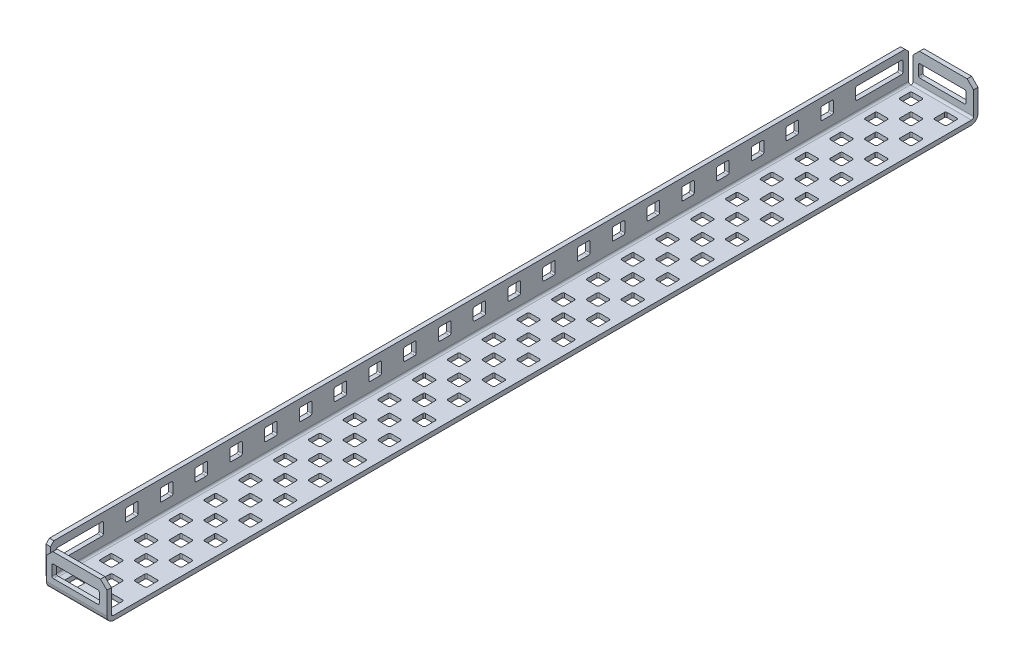
from build123d import *

# Parameters (mm, degrees)
BOSS_EXTRUDE1_DEPTH  = 313.436
CUT_EXTRUDE1_DEPTH   = 315.676979316
CUT_EXTRUDE2_DEPTH   = 315.676979316
LPATTERN1_COUNT      = 21
LPATTERN1_PITCH      = 12.7
CUT_EXTRUDE3_DEPTH   = 315.613333758
LPATTERN2_COUNT      = 2
LPATTERN2_PITCH      = 12.7
LPATTERN2_COUNT_DIR2 = 25
LPATTERN2_PITCH_DIR2 = 12.7
CUT_EXTRUDE4_DEPTH   = 315.613333758
LPATTERN3_COUNT      = 24
LPATTERN3_PITCH      = 12.7
BOSS_EXTRUDE2_DEPTH  = 22.098
CUT_EXTRUDE5_DEPTH   = 320.433628506


with BuildPart() as part:
    # Sketch1 → Boss-Extrude1 (new body)
    with BuildSketch(Plane.XY):
        with BuildLine():
            Line((0, 0), (-22.098, 0))
            ThreePointArc((-22.098, 0), (-23.894051224, 0.743948776), (-24.638, 2.54))
            Line((-24.638, 2.54), (-24.638, 13.1318))
            Line((-24.638, 13.1318), (-23.0124, 13.1318))
            Line((-23.0124, 13.1318), (-23.0124, 2.3876))
            ThreePointArc((-23.0124, 2.3876), (-22.789215367, 1.848784633), (-22.2504, 1.6256))
            Line((-22.2504, 1.6256), (0, 1.6256))
            Line((0, 1.6256), (0, 0))
        make_face()
    extrude(amount=-BOSS_EXTRUDE1_DEPTH)

    # Sketch3 → Cut-Extrude1 (cut, through all)
    with BuildSketch(Plane.ZY.offset(24.638)):
        with BuildLine():
            Line((-2.54, 10.3378), (-18.796, 10.3378))
            ThreePointArc((-18.796, 10.3378), (-19.155210245, 10.189010245), (-19.304, 9.8298))
            Line((-19.304, 9.8298), (-19.304, 6.2738))
            ThreePointArc((-19.304, 6.2738), (-19.155210245, 5.914589755), (-18.796, 5.7658))
            Line((-18.796, 5.7658), (-2.54, 5.7658))
            ThreePointArc((-2.54, 5.7658), (-2.180789755, 5.914589755), (-2.032, 6.2738))
            Line((-2.032, 6.2738), (-2.032, 9.8298))
            ThreePointArc((-2.032, 9.8298), (-2.180789755, 10.189010245), (-2.54, 10.3378))
        make_face()
        Polygon((-1.257235857, 13.1318), (0, 11.874564143), (0, 13.1318), align=None)
        Polygon((-313.436, 13.1318), (-313.436, 11.874564143), (-312.178764143, 13.1318), align=None)
        with BuildLine():
            Line((-310.896, 10.3378), (-294.64, 10.3378))
            ThreePointArc((-294.64, 10.3378), (-294.280789755, 10.189010245), (-294.132, 9.8298))
            Line((-294.132, 9.8298), (-294.132, 6.2738))
            ThreePointArc((-294.132, 6.2738), (-294.280789755, 5.914589755), (-294.64, 5.7658))
            Line((-294.64, 5.7658), (-310.896, 5.7658))
            ThreePointArc((-310.896, 5.7658), (-311.255210245, 5.914589755), (-311.404, 6.2738))
            Line((-311.404, 6.2738), (-311.404, 9.8298))
            ThreePointArc((-311.404, 9.8298), (-311.255210245, 10.189010245), (-310.896, 10.3378))
        make_face()
    extrude(amount=-CUT_EXTRUDE1_DEPTH, mode=Mode.SUBTRACT)

    # Sketch4 → Cut-Extrude2 (cut, through all)
    with BuildSketch(Plane.ZY.offset(24.638)):
        with BuildLine():
            Line((-27.94, 10.3378), (-31.496, 10.3378))
            ThreePointArc((-31.496, 10.3378), (-31.855210245, 10.189010245), (-32.004, 9.8298))
            Line((-32.004, 9.8298), (-32.004, 6.2738))
            ThreePointArc((-32.004, 6.2738), (-31.855210245, 5.914589755), (-31.496, 5.7658))
            Line((-31.496, 5.7658), (-27.94, 5.7658))
            ThreePointArc((-27.94, 5.7658), (-27.580789755, 5.914589755), (-27.432, 6.2738))
            Line((-27.432, 6.2738), (-27.432, 9.8298))
            ThreePointArc((-27.432, 9.8298), (-27.580789755, 10.189010245), (-27.94, 10.3378))
        make_face()
    cut_extrude2 = extrude(amount=-CUT_EXTRUDE2_DEPTH, mode=Mode.SUBTRACT)

    # LPattern1: Cut-Extrude2 ×21
    with Locations(*[(0, 0, -i * LPATTERN1_PITCH) for i in range(1, LPATTERN1_COUNT)]):
        add(cut_extrude2, mode=Mode.SUBTRACT)

    # Sketch5 → Cut-Extrude3 (cut, through all)
    with BuildSketch(Plane(origin=(0, 1.6256, 0), x_dir=(1, 0, 0), z_dir=(0, 1, 0))):
        with BuildLine():
            Line((-3.302, 2.032), (-6.858, 2.032))
            ThreePointArc((-6.858, 2.032), (-7.217210245, 2.180789755), (-7.366, 2.54))
            Line((-7.366, 2.54), (-7.366, 6.096))
            ThreePointArc((-7.366, 6.096), (-7.217210245, 6.455210245), (-6.858, 6.604))
            Line((-6.858, 6.604), (-3.302, 6.604))
            ThreePointArc((-3.302, 6.604), (-2.942789755, 6.455210245), (-2.794, 6.096))
            Line((-2.794, 6.096), (-2.794, 2.54))
            ThreePointArc((-2.794, 2.54), (-2.942789755, 2.180789755), (-3.302, 2.032))
        make_face()
    cut_extrude3 = extrude(amount=-CUT_EXTRUDE3_DEPTH, mode=Mode.SUBTRACT)

    # LPattern2: Cut-Extrude3 2 × 25
    with Locations(*[(-i * LPATTERN2_PITCH, 0, -j * LPATTERN2_PITCH_DIR2) for i in range(LPATTERN2_COUNT) for j in range(LPATTERN2_COUNT_DIR2) if (i, j) != (0, 0)]):
        add(cut_extrude3, mode=Mode.SUBTRACT)

    # Sketch6 → Cut-Extrude4 (cut, through all)
    with BuildSketch(Plane(origin=(0, 1.6256, 0), x_dir=(1, 0, 0), z_dir=(0, 1, 0))):
        with BuildLine():
            Line((-13.208, 12.954), (-9.652, 12.954))
            ThreePointArc((-9.652, 12.954), (-9.292789755, 12.805210245), (-9.144, 12.446))
            Line((-9.144, 12.446), (-9.144, 8.89))
            ThreePointArc((-9.144, 8.89), (-9.292789755, 8.530789755), (-9.652, 8.382))
            Line((-9.652, 8.382), (-13.208, 8.382))
            ThreePointArc((-13.208, 8.382), (-13.567210245, 8.530789755), (-13.716, 8.89))
            Line((-13.716, 8.89), (-13.716, 12.446))
            ThreePointArc((-13.716, 12.446), (-13.567210245, 12.805210245), (-13.208, 12.954))
        make_face()
    cut_extrude4 = extrude(amount=-CUT_EXTRUDE4_DEPTH, mode=Mode.SUBTRACT)

    # LPattern3: Cut-Extrude4 ×24
    with Locations(*[(0, 0, -i * LPATTERN3_PITCH) for i in range(1, LPATTERN3_COUNT)]):
        add(cut_extrude4, mode=Mode.SUBTRACT)

    # Sketch7 → Boss-Extrude2 (add)
    with BuildSketch(Plane(origin=(0, 0, 0), x_dir=(0, 0, -1), z_dir=(1, 0, 0))):
        with BuildLine():
            Line((0, 0), (0, 1.6256))
            ThreePointArc((0, 1.6256), (-0.538815367, 1.848784633), (-0.762, 2.3876))
            Line((-0.762, 2.3876), (-0.762, 13.1318))
            Line((-0.762, 13.1318), (-2.3876, 13.1318))
            Line((-2.3876, 13.1318), (-2.3876, 2.535423878))
            ThreePointArc((-2.3876, 2.535423878), (-1.696747912, 0.794087609), (0, 0))
        make_face()
        with BuildLine():
            Line((314.198, 2.3876), (314.198, 13.1318))
            Line((314.198, 13.1318), (315.8236, 13.1318))
            Line((315.8236, 13.1318), (315.8236, 2.535423878))
            ThreePointArc((315.8236, 2.535423878), (315.132747912, 0.794087609), (313.436, 0))
            Line((313.436, 0), (313.436, 1.6256))
            ThreePointArc((313.436, 1.6256), (313.974815367, 1.848784633), (314.198, 2.3876))
        make_face()
    extrude(amount=-BOSS_EXTRUDE2_DEPTH)

    # Sketch8 → Cut-Extrude5 (cut, through all)
    with BuildSketch(Plane.XY.offset(2.3876)):
        with BuildLine():
            Line((-19.558, 9.271086354), (-3.302, 9.271086354))
            ThreePointArc((-3.302, 9.271086354), (-2.942789755, 9.122296599), (-2.794, 8.763086354))
            Line((-2.794, 8.763086354), (-2.794, 5.207086354))
            ThreePointArc((-2.794, 5.207086354), (-2.942789755, 4.847876109), (-3.302, 4.699086354))
            Line((-3.302, 4.699086354), (-19.558, 4.699086354))
            ThreePointArc((-19.558, 4.699086354), (-19.917210245, 4.847876109), (-20.066, 5.207086354))
            Line((-20.066, 5.207086354), (-20.066, 8.763086354))
            ThreePointArc((-20.066, 8.763086354), (-19.917210245, 9.122296599), (-19.558, 9.271086354))
        make_face()
        Polygon((-22.098, 10.796933409), (-19.763133409, 13.1318), (-22.098, 13.1318), align=None)
        Polygon((0, 10.796933409), (-2.334866591, 13.1318), (0, 13.1318), align=None)
    extrude(amount=-CUT_EXTRUDE5_DEPTH, mode=Mode.SUBTRACT)


solid = part.part
